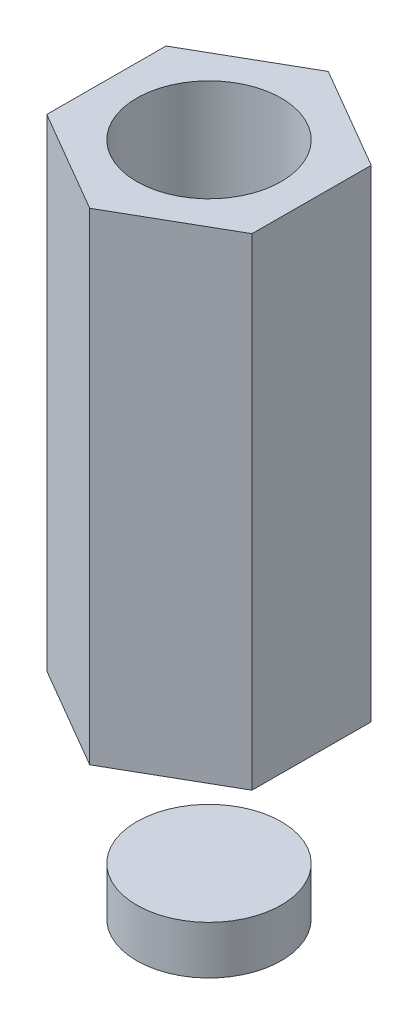
from build123d import *

# Parameters (mm, degrees)
ESQUISSE1_R             = 1.5
BOSS_EXTRU_1_DEPTH      = 4
BOSS_EXTRU_2_DEPTH      = 10
ENL_V_START             = -4
ESQUISSE3_R             = 1.5
ENL_V_MAT_EXTRU_1_DEPTH = 4
PER_AGE1_START          = 1
PER_AGE1_OUTLINE_R      = 1.5
PER_AGE1_DEPTH          = 3


# Read off the part's stored shape, not the designer's step: Perçage1
with BuildPart() as part:
    # Esquisse1 → Boss.-Extru.1 (new body)
    with BuildSketch(Plane(origin=(0, 0, 0), x_dir=(1, 0, 0), z_dir=(0, 1, 0))):
        with Locations(Location((0, 0, 0), (0, 0, 270))):
            Circle(ESQUISSE1_R)
    extrude(amount=BOSS_EXTRU_1_DEPTH)

    # Esquisse2 → Boss.-Extru.2 (add)
    with BuildSketch(Plane(origin=(0, 4, 0), x_dir=(-1, 0, 0), z_dir=(0, 1, 0))):
        Polygon((2.131865991, -1.240236504), (2.140009315, 1.226131853), (0.008143324, 2.466368358), (-2.131865991, 1.240236504), (-2.140009315, -1.226131853), (-0.008143324, -2.466368358), align=None)
    extrude(amount=BOSS_EXTRU_2_DEPTH)

    # Esquisse3 → Enlèv. mat.-Extru.1 (cut)
    with BuildSketch(Plane(origin=(0, 14, 0), x_dir=(-1, 0, 0), z_dir=(0, 1, 0)).offset(ENL_V_START)):
        with Locations(Location((0, 0, 0), (0, 0, 90))):
            Circle(ESQUISSE3_R)
    extrude(amount=ENL_V_MAT_EXTRU_1_DEPTH, mode=Mode.SUBTRACT)

    # Perçage1 outline → Perçage1 (cut)
    with BuildSketch(Plane(origin=(0, 0, 0), x_dir=(1, 0, 0), z_dir=(0, 1, 0)).offset(PER_AGE1_START)):
        Circle(PER_AGE1_OUTLINE_R)
    extrude(amount=PER_AGE1_DEPTH, mode=Mode.SUBTRACT)


solid = part.part
